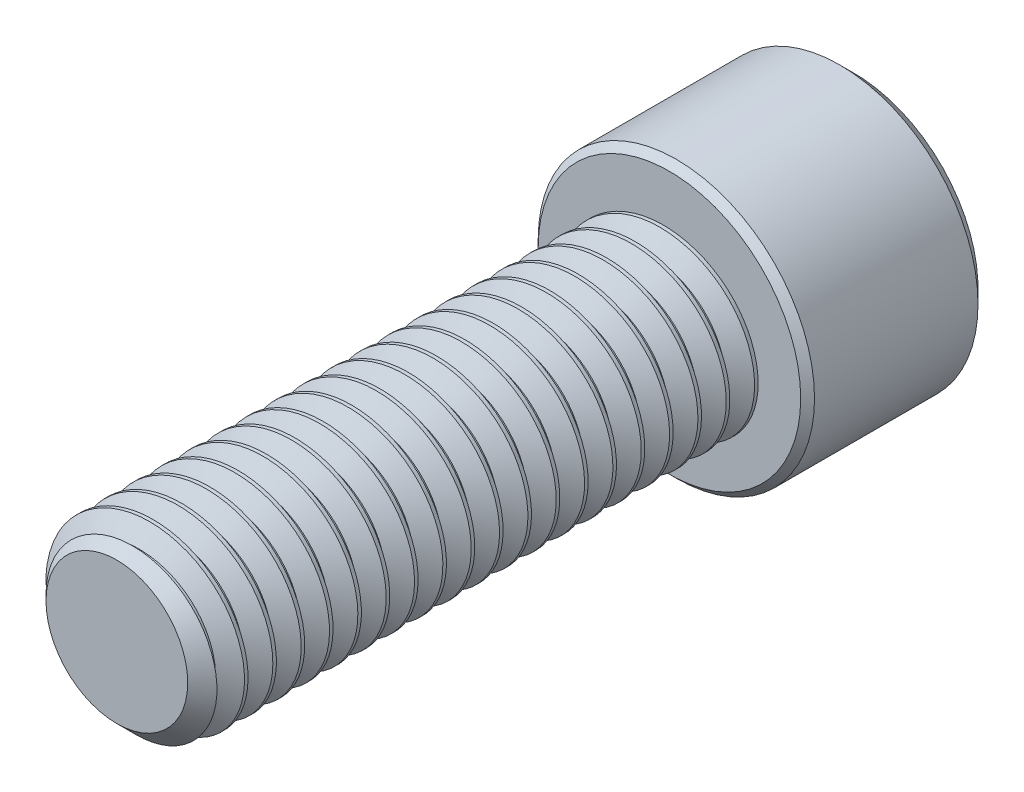
from build123d import *

# Parameters (mm, degrees)
SKETCH1_R          = 6.35
EXTRUDE1_DEPTH     = 38.1
CHAMFER3_SIZE      = 1.465384615
CUT_SWEEP1_PITCH   = 1.953846154
SKETCH6_R          = 9.525
EXTRUDE2_DEPTH     = 12.7
CUT_EXTRUDE1_DEPTH = 7.14375
CHAMFER1_SIZE      = 0.9525
CHAMFER2_SIZE      = 0.47625


with BuildPart() as part:
    # Sketch1 → Extrude1 (new body)
    with BuildSketch(Plane.XY):
        Circle(SKETCH1_R)
    extrude(amount=-EXTRUDE1_DEPTH)

    # Chamfer3
    chamfer3_edges = [part.edges().sort_by_distance(p)[0] for p in [
        (-6.35, 0, 0),
    ]]
    chamfer(chamfer3_edges, length=CHAMFER3_SIZE)

    # Cut-Sweep1: the profile of Sketch3 profile screwed along a right-hand helix of 20.5 turns, 6 arcs to a turn; built about Z, then put on its axis
    cut_sweep1_z = Axis((0, 0, 0), (0, 0, 1))
    cut_sweep1_corners = [(6.3503, 0, -1.70978859), (5.080939697, 0, -0.976923077), (5.080939697, 0, -0.732692308), (6.3503, 0, 0.000173205)]
    with BuildLine(mode=Mode.PRIVATE) as cut_sweep1_profile:
        Line(cut_sweep1_corners[0], cut_sweep1_corners[1])
        Line(cut_sweep1_corners[1], cut_sweep1_corners[2])
        Line(cut_sweep1_corners[2], cut_sweep1_corners[3])
        Line(cut_sweep1_corners[3], cut_sweep1_corners[0])
    cut_sweep1_cap = Face(cut_sweep1_profile.wire())
    cut_sweep1_turn_angles = [0, 30, 60, 90, 120, 150, 180, 210, 240, 270, 300, 330, 360]
    cut_sweep1_turn_weights = [1, 0.8660254037844387, 1, 0.8660254037844387, 1, 0.8660254037844387, 1, 0.8660254037844387, 1, 0.8660254037844387, 1, 0.8660254037844387, 1]
    cut_sweep1_turn_rails = [Edge.make_bspline([Vector(p[0], p[1], 0).rotate(cut_sweep1_z, cut_sweep1_turn_angles[k]) / cut_sweep1_turn_weights[k] + Vector(0, 0, p[2] + CUT_SWEEP1_PITCH * cut_sweep1_turn_angles[k] / 360) for k in range(13)], [0, 0, 0, 1, 1, 2, 2, 3, 3, 4, 4, 5, 5, 6, 6, 6], 2, cut_sweep1_turn_weights) for p in cut_sweep1_corners]
    cut_sweep1_turn_sides = [Face.make_surface_from_curves(cut_sweep1_turn_rails[p[0]], cut_sweep1_turn_rails[p[1]]) for p in [(0, 1), (1, 2), (2, 3), (3, 0)]]
    cut_sweep1_last_angles = [7200, 7230, 7260, 7290, 7320, 7350, 7380]
    cut_sweep1_last_weights = [1, 0.8660254037844387, 1, 0.8660254037844387, 1, 0.8660254037846689, 1]
    cut_sweep1_last_rails = [Edge.make_bspline([Vector(p[0], p[1], 0).rotate(cut_sweep1_z, cut_sweep1_last_angles[k]) / cut_sweep1_last_weights[k] + Vector(0, 0, p[2] + CUT_SWEEP1_PITCH * cut_sweep1_last_angles[k] / 360) for k in range(7)], [0, 0, 0, 1, 1, 2, 2, 3, 3, 3], 2, cut_sweep1_last_weights) for p in cut_sweep1_corners]
    cut_sweep1_last_sides = [Face.make_surface_from_curves(cut_sweep1_last_rails[p[0]], cut_sweep1_last_rails[p[1]]) for p in [(0, 1), (1, 2), (2, 3), (3, 0)]]
    cut_sweep1 = Plane(origin=(0, 0, 0), x_dir=(0, 1, 0), z_dir=(0, 0, -1)) * Solid(Shell([*[p.moved(Location((0, 0, CUT_SWEEP1_PITCH * i))) for i in range(20) for p in cut_sweep1_turn_sides], *cut_sweep1_last_sides, cut_sweep1_cap, cut_sweep1_cap.rotate(cut_sweep1_z, 7380).moved(Location((0, 0, CUT_SWEEP1_PITCH * 7380 / 360)))]))
    add(cut_sweep1, mode=Mode.SUBTRACT)

    # Sketch6 → Extrude2 (add)
    with BuildSketch(Plane(origin=(0, 0, -38.1), x_dir=(-1, 0, 0), z_dir=(0, 0, -1))):
        Circle(SKETCH6_R)
    extrude(amount=EXTRUDE2_DEPTH)

    # Sketch7 → Cut-Extrude1 (cut)
    with BuildSketch(Plane(origin=(0, 0, -50.8), x_dir=(-1, 0, 0), z_dir=(0, 0, -1))):
        Polygon((0, 5.499261314), (-4.7625, 2.749630657), (-4.7625, -2.749630657), (0, -5.499261314), (4.7625, -2.749630657), (4.7625, 2.749630657), align=None)
    extrude(amount=-CUT_EXTRUDE1_DEPTH, mode=Mode.SUBTRACT)

    # Cut-Extrude2 cone 1 section (through the dimple's axis) → Cut-Extrude2 (revolve, cut)
    with BuildSketch(Plane(origin=(0, 0, -50.8), x_dir=(0, 1, 0), z_dir=(1, 0, 0))):
        Polygon((0, 0), (5.499261314, 0), (0, 5.499261314), align=None)
    revolve(axis=Axis((0, 0, -50.8), (0, 0, 1)), mode=Mode.SUBTRACT)

    # Chamfer1
    chamfer1_edges = [part.edges().sort_by_distance(p)[0] for p in [
        (9.525, 0, -50.8),
    ]]
    chamfer(chamfer1_edges, length=CHAMFER1_SIZE)

    # Chamfer2
    chamfer2_edges = [part.edges().sort_by_distance(p)[0] for p in [
        (9.525, 0, -38.1),
    ]]
    chamfer(chamfer2_edges, length=CHAMFER2_SIZE)


solid = part.part
